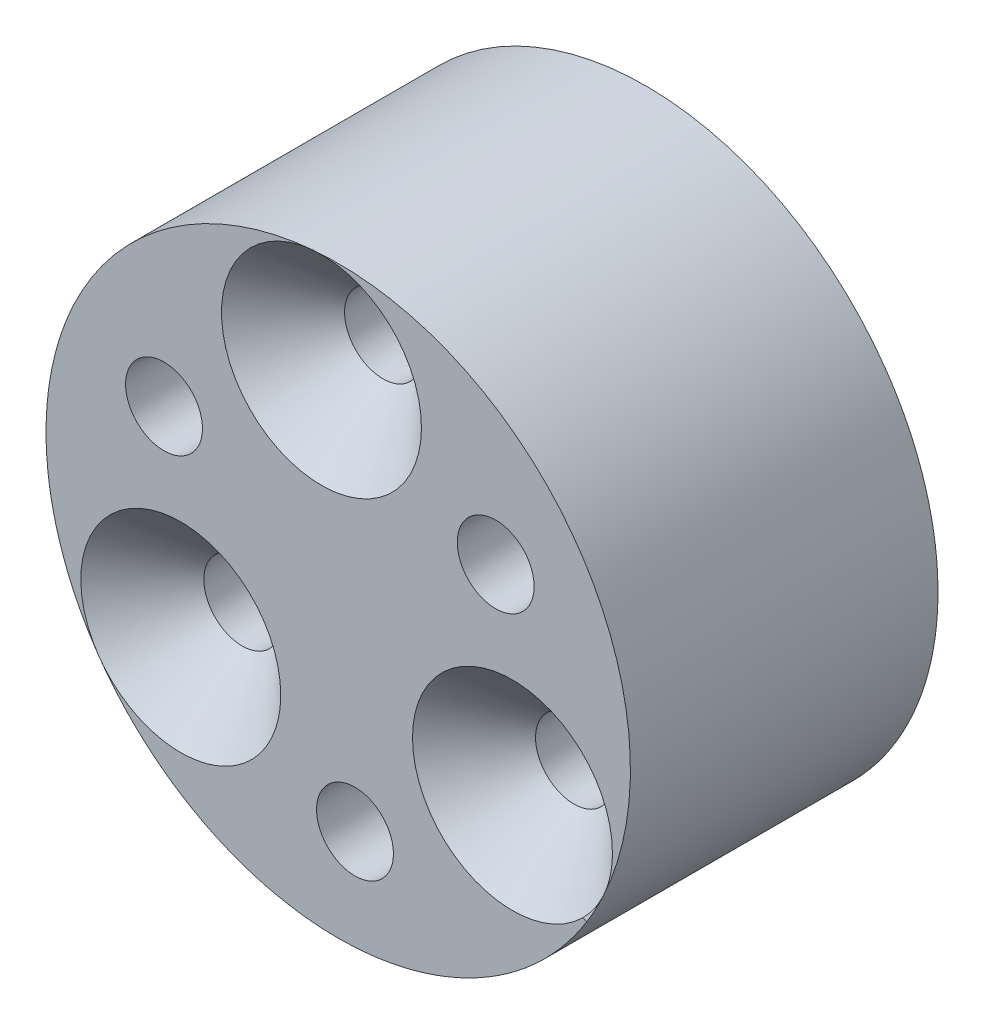
from build123d import *

# Parameters (mm, degrees)
SKETCH1_R           = 9.5
SKETCH1_R_2         = 1.25
BOSS_EXTRUDE1_DEPTH = 10
CHAMFER1_SIZE       = 2
CHAMFER2_SIZE       = 2


with BuildPart() as part:
    # Sketch1 → Boss-Extrude1 (new body)
    with BuildSketch(Plane.XY):
        with Locations((0, -40)):
            Circle(SKETCH1_R)
        with Locations((5.119700277, -36.415147273)):
            Circle(SKETCH1_R_2, mode=Mode.SUBTRACT)
        with Locations((0.544723392, -46.226216863)):
            Circle(SKETCH1_R_2, mode=Mode.SUBTRACT)
        with Locations((-5.664423669, -37.358635864)):
            Circle(SKETCH1_R_2, mode=Mode.SUBTRACT)
        with Locations((-5.119700277, -43.584852727)):
            Circle(SKETCH1_R_2, mode=Mode.SUBTRACT)
        with Locations((-0.544723392, -33.773783137)):
            Circle(SKETCH1_R_2, mode=Mode.SUBTRACT)
        with Locations((5.664423669, -42.641364136)):
            Circle(SKETCH1_R_2, mode=Mode.SUBTRACT)
    extrude(amount=BOSS_EXTRUDE1_DEPTH)

    # Chamfer1
    chamfer1_edges = [part.edges().sort_by_distance(p)[0] for p in [
        (-6.369700277, -43.584852727, 10),
        (-1.794723392, -33.773783137, 10),
        (4.414423669, -42.641364136, 10),
    ]]
    chamfer(chamfer1_edges, length=CHAMFER1_SIZE - 0.0001)  # a hair under: the kernel refuses the full size

    # Chamfer2
    chamfer2_edges = [part.edges().sort_by_distance(p)[0] for p in [
        (-6.914423669, -37.358635864, 0),
        (3.869700277, -36.415147273, 0),
        (-0.705276608, -46.226216863, 0),
    ]]
    chamfer(chamfer2_edges, length=CHAMFER2_SIZE - 0.0001)  # a hair under: the kernel refuses the full size


solid = part.part
